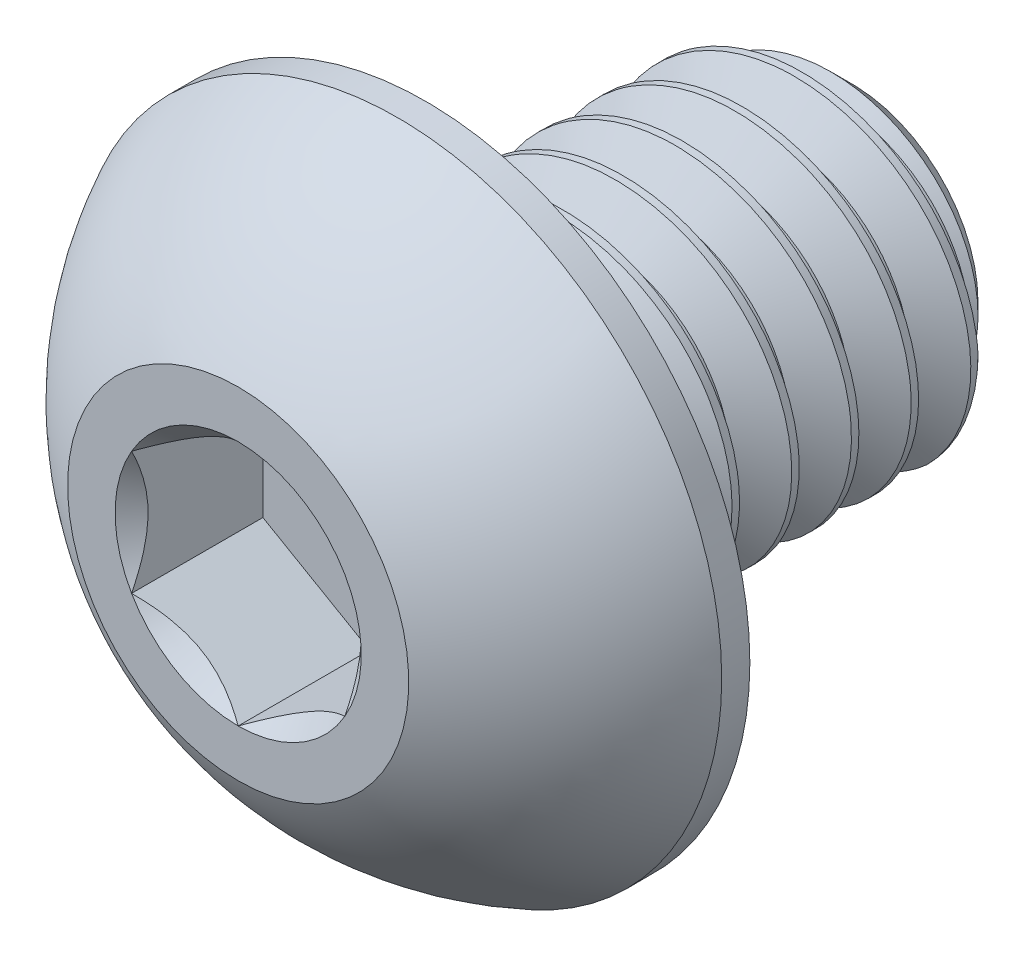
from build123d import *

# Parameters (mm, degrees)
CUT_EXTRUDE2_DEPTH = 1.54
CUT_SWEEP2_PITCH   = 0.7


# Read off the part's stored shape, not the designer's step: Split1
with BuildPart() as part:
    # Sketch10 → Revolve3 (revolve)
    with BuildSketch(Plane(origin=(0, 0, 0), x_dir=(0, 0, -1), z_dir=(1, 0, 0)), mode=Mode.PRIVATE) as revolve3_sk:
        Polygon((6.675, 2), (7.2, 1.475), (7.2, 0), (2.2, 0), (2.2, 2), align=None)
    revolve(revolve3_sk.sketch.rotate(Axis((0, 0, 0), (0, 0, -1)), 90), axis=Axis((0, 0, 0), (0, 0, -1)))

    # Sketch7 → Revolve2 (revolve)
    with BuildSketch(Plane(origin=(0, 0, 0), x_dir=(0, 0, -1), z_dir=(1, 0, 0)), mode=Mode.PRIVATE) as revolve2_sk:
        with BuildLine():
            Line((1.87, 3.8), (2.2, 3.8))
            Line((2.2, 3.8), (2.2, 0))
            Line((2.2, 0), (0, 0))
            Line((0, 0), (0, 2))
            ThreePointArc((0, 2), (0.793500147, 3.047002626), (1.87, 3.8))
        make_face()
    revolve(revolve2_sk.sketch.rotate(Axis((0, 0, 0), (0, 0, -1)), 180), axis=Axis((0, 0, 0), (0, 0, -1)))

    # Sketch5 → Cut-Extrude2 (cut)
    with BuildSketch(Plane.XY):
        Polygon((1.25, -0.721687836), (1.25, 0.721687836), (0, 1.443375673), (-1.25, 0.721687836), (-1.25, -0.721687836), (0, -1.443375673), align=None)
    extrude(amount=-CUT_EXTRUDE2_DEPTH, mode=Mode.SUBTRACT)

    # Cut-Extrude3 cone 1 section (through the dimple's axis) → Cut-Extrude3 (revolve, cut)
    with BuildSketch(Plane(origin=(0, 0, 0), x_dir=(0, -1, 0), z_dir=(1, 0, 0))):
        Polygon((0, 0), (1.443375673, 0), (0, 1.443375673), align=None)
    revolve(axis=Axis((0, 0, 0), (0, 0, -1)), mode=Mode.SUBTRACT)


with BuildPart() as body_2:
    # Split1: the piece on the far side of the plane
    add(part.part)
    split(bisect_by=Plane.XY.offset(-2.2), keep=Keep.BOTTOM)

    # Cut-Sweep2: the profile of Sketch12 screwed along a right-hand helix of 10.285714 turns, 6 arcs to a turn; built about Z, then put on its axis
    cut_sweep2_z = Axis((0, 0, 0), (0, 0, 1))
    cut_sweep2_corners = [(1.545336663, 0, -0.2625), (1.545336663, 0, -0.35), (2.037888611, 0, -0.634375), (2.037888611, 0, 0.021875)]
    with BuildLine(mode=Mode.PRIVATE) as cut_sweep2_profile:
        Line(cut_sweep2_corners[0], cut_sweep2_corners[1])
        Line(cut_sweep2_corners[1], cut_sweep2_corners[2])
        Line(cut_sweep2_corners[2], cut_sweep2_corners[3])
        Line(cut_sweep2_corners[3], cut_sweep2_corners[0])
    cut_sweep2_cap = Face(cut_sweep2_profile.wire())
    cut_sweep2_turn_angles = [0, 30, 60, 90, 120, 150, 180, 210, 240, 270, 300, 330, 360]
    cut_sweep2_turn_weights = [1, 0.8660254037844387, 1, 0.8660254037844387, 1, 0.8660254037844387, 1, 0.8660254037844387, 1, 0.8660254037844387, 1, 0.8660254037844387, 1]
    cut_sweep2_turn_rails = [Edge.make_bspline([Vector(p[0], p[1], 0).rotate(cut_sweep2_z, cut_sweep2_turn_angles[k]) / cut_sweep2_turn_weights[k] + Vector(0, 0, p[2] + CUT_SWEEP2_PITCH * cut_sweep2_turn_angles[k] / 360) for k in range(13)], [0, 0, 0, 1, 1, 2, 2, 3, 3, 4, 4, 5, 5, 6, 6, 6], 2, cut_sweep2_turn_weights) for p in cut_sweep2_corners]
    cut_sweep2_turn_sides = [Face.make_surface_from_curves(cut_sweep2_turn_rails[p[0]], cut_sweep2_turn_rails[p[1]]) for p in [(0, 1), (1, 2), (2, 3), (3, 0)]]
    cut_sweep2_turn = Solid(Shell([*cut_sweep2_turn_sides, cut_sweep2_cap, cut_sweep2_cap.rotate(cut_sweep2_z, 360).moved(Location((0, 0, CUT_SWEEP2_PITCH * 360 / 360)))]))
    cut_sweep2_last_angles = [3600, 3630, 3660, 3681.428571429, 3702.857142857]
    cut_sweep2_last_weights = [1, 0.8660254037844387, 1, 0.9308737486441628, 1]
    cut_sweep2_last_rails = [Edge.make_bspline([Vector(p[0], p[1], 0).rotate(cut_sweep2_z, cut_sweep2_last_angles[k]) / cut_sweep2_last_weights[k] + Vector(0, 0, p[2] + CUT_SWEEP2_PITCH * cut_sweep2_last_angles[k] / 360) for k in range(5)], [0, 0, 0, 1, 1, 2, 2, 2], 2, cut_sweep2_last_weights) for p in cut_sweep2_corners]
    cut_sweep2_last_sides = [Face.make_surface_from_curves(cut_sweep2_last_rails[p[0]], cut_sweep2_last_rails[p[1]]) for p in [(0, 1), (1, 2), (2, 3), (3, 0)]]
    cut_sweep2_last = Solid(Shell([*cut_sweep2_last_sides, cut_sweep2_cap.rotate(cut_sweep2_z, 3600).moved(Location((0, 0, CUT_SWEEP2_PITCH * 3600 / 360))), cut_sweep2_cap.rotate(cut_sweep2_z, 3702.857142857).moved(Location((0, 0, CUT_SWEEP2_PITCH * 3702.857142857 / 360)))]))
    cut_sweep2_each = [*[cut_sweep2_turn.moved(Location((0, 0, CUT_SWEEP2_PITCH * i))) for i in range(10)], cut_sweep2_last]
    add(Plane(origin=(0, 0, -7.2), x_dir=(0, 1, 0), z_dir=(0, 0, 1)) * Compound([cut_sweep2_each[i] for i in range(0, 11, 2)]), mode=Mode.SUBTRACT)
    add(Plane(origin=(0, 0, -7.2), x_dir=(0, 1, 0), z_dir=(0, 0, 1)) * Compound([cut_sweep2_each[i] for i in range(1, 11, 2)]), mode=Mode.SUBTRACT)


with BuildPart() as part_1:
    add(part.part)

    # Split1
    split(bisect_by=Plane.XY.offset(-2.2), keep=Keep.TOP)

    add(body_2.part)  # Boss-Extrude1 merges body 2
    # Boss-Extrude1 cone 1 section (through the dimple's axis) → Boss-Extrude1 (revolve)
    with BuildSketch(Plane(origin=(0, 0, -2.2), x_dir=(0, -1, 0), z_dir=(1, 0, 0))):
        Polygon((0, 0), (2, 0), (0, 2), align=None)
    revolve(axis=Axis((0, 0, -2.2), (0, 0, -1)))


solid = part_1.part
